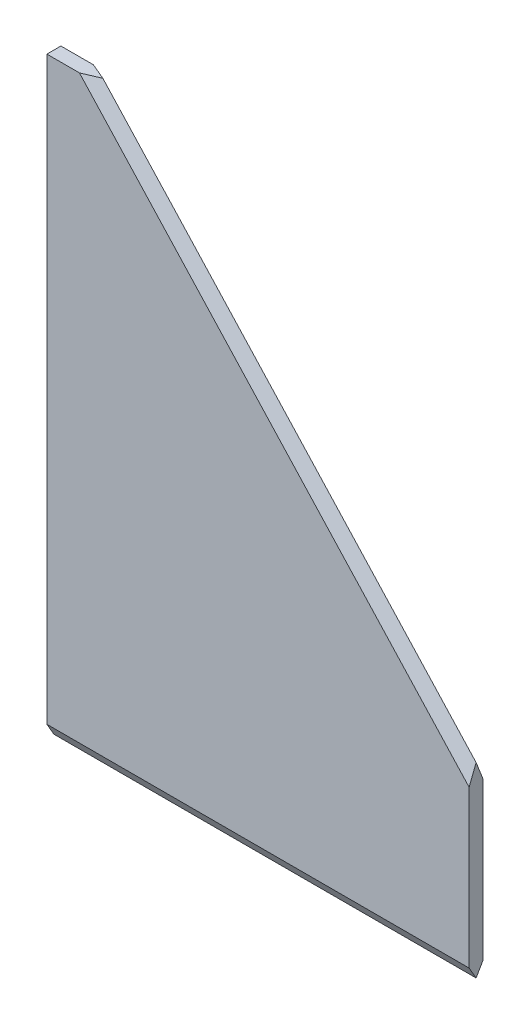
from build123d import *

# Parameters (mm, degrees)
BOSS_EXTRUDE1_DEPTH = 3
CHAMFER7_SIZE       = 1.5
CHAMFER7_SIZE_2     = 2.598076211


with BuildPart() as part:
    # Sketch1 → Boss-Extrude1 (new body)
    with BuildSketch(Plane.XY):
        Polygon((90.5, 0), (90.5, 40), (10.5, 127), (0, 127), (0, 0), align=None)
    extrude(amount=BOSS_EXTRUDE1_DEPTH)

    # Chamfer7
    # the kernel refuses this chamfer: 2.598076211, 1.5 mm, written as the material it takes off along each edge
    with BuildSketch(Plane(origin=(-6.721445956, 0, 3), x_dir=(0, -0.0578938624026714, -0.9983227437537926), z_dir=(1, 0, 0))) as chamfer7_piece_1:
        Polygon((CHAMFER7_SIZE * 0.998322743754, CHAMFER7_SIZE * 0.0578938624027), (-CHAMFER7_SIZE_2 * 0.0578938624105, CHAMFER7_SIZE_2 * 0.99832274389), (0, 0), align=None)
    extrude(amount=103.942891912, mode=Mode.SUBTRACT)
    with BuildSketch(Plane(origin=(-6.721445956, 0, 0), x_dir=(0, -0.0578938624026714, 0.9983227437537926), z_dir=(1, 0, 0))) as chamfer7_piece_2:
        Polygon((CHAMFER7_SIZE * 0.998322743754, -CHAMFER7_SIZE * 0.0578938624027), (-CHAMFER7_SIZE_2 * 0.0578938624105, -CHAMFER7_SIZE_2 * 0.99832274389), (0, 0), align=None)
    extrude(amount=103.942891912, mode=Mode.SUBTRACT)
    with BuildSketch(Plane(origin=(95.04956673, 35.052346181, 3), x_dir=(0.042615650155104184, 0.03918680474032571, -0.9983227437537929), z_dir=(-0.6768732144311417, 0.7360996206938663, 0))) as chamfer7_piece_3:
        Polygon((CHAMFER7_SIZE * 0.998322743754, CHAMFER7_SIZE * 0.0578938624027), (-CHAMFER7_SIZE_2 * 0.0578938624105, CHAMFER7_SIZE_2 * 0.99832274389), (0, 0), align=None)
    extrude(amount=131.633416067, mode=Mode.SUBTRACT)
    with BuildSketch(Plane(origin=(95.04956673, 35.052346181, 0), x_dir=(0.042615650155104184, 0.03918680474032571, 0.9983227437537929), z_dir=(-0.6768732144311417, 0.7360996206938663, 0))) as chamfer7_piece_4:
        Polygon((CHAMFER7_SIZE * 0.998322743754, -CHAMFER7_SIZE * 0.0578938624027), (-CHAMFER7_SIZE_2 * 0.0578938624105, -CHAMFER7_SIZE_2 * 0.99832274389), (0, 0), align=None)
    extrude(amount=131.633416067, mode=Mode.SUBTRACT)


solid = part.part
